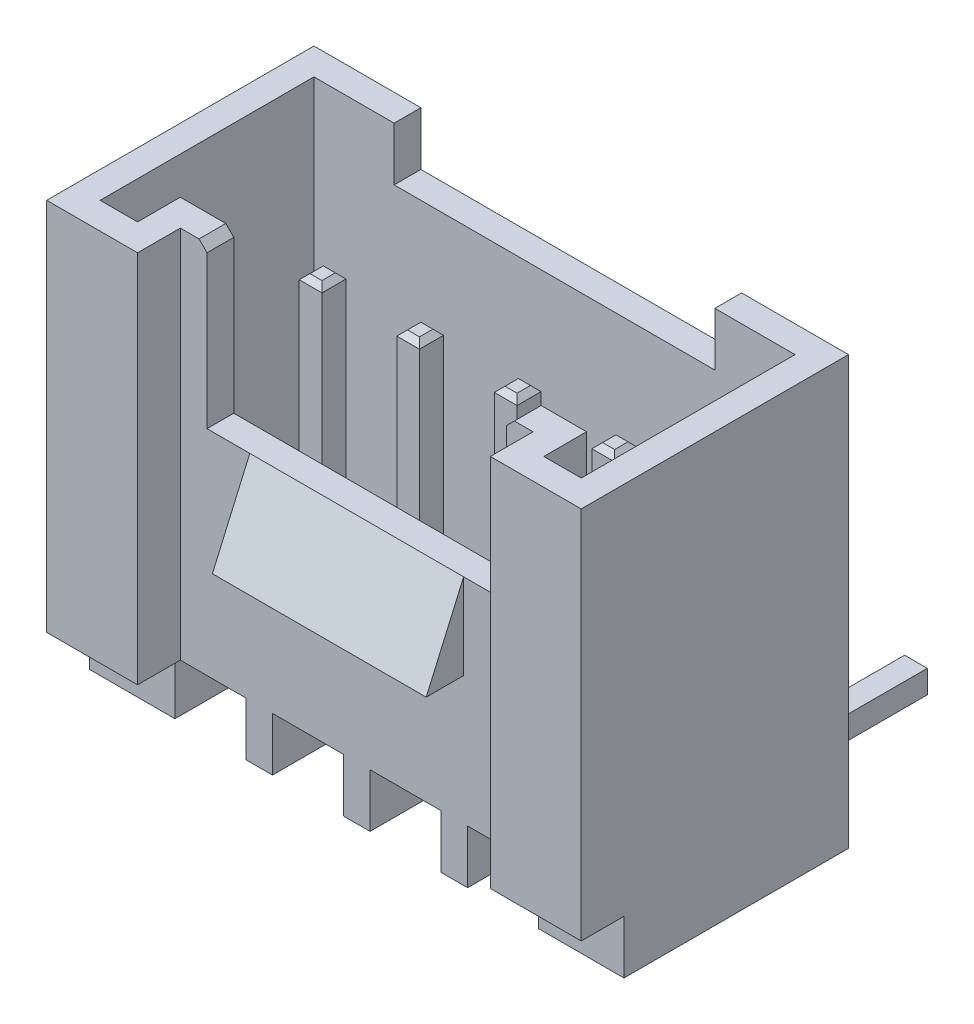
from build123d import *

# Parameters (mm, degrees)
ESQUISSE1_W             = 10
ESQUISSE1_H             = 5
BOSS_EXTRU_1_DEPTH      = 8
ESQUISSE2_W             = 6.6
ESQUISSE2_H             = 0.8
ENL_V_MAT_EXTRU_1_DEPTH = 8
ENL_V_MAT_EXTRU_2_DEPTH = 6.5
ESQUISSE5_W             = 6
ESQUISSE5_H             = 0.5
ENL_V_MAT_EXTRU_3_DEPTH = 1
ESQUISSE6_W             = 5.6
ESQUISSE6_H             = 0.5
ENL_V_MAT_EXTRU_4_DEPTH = 3
ESQUISSE7_W             = 0.8
ESQUISSE7_H             = 1
ENL_V_MAT_EXTRU_5_DEPTH = 10
ESQUISSE8_W             = 6.8
ESQUISSE8_H             = 4.2
ENL_V_MAT_EXTRU_6_DEPTH = 1
BOSS_EXTRU_2_DEPTH      = 6.8
BOSS_EXTRU_3_DEPTH      = 2
BOSS_EXTRU_3_DEPTH_BACK = 2
ESQUISSE12_W            = 0.5
ESQUISSE12_H            = 4.2
BOSS_EXTRU_4_DEPTH      = 1
CHANFREIN1_SIZE         = 0.15
BOSS_EXTRU_5_DEPTH      = 0.5
BOSS_EXTRU_5_DEPTH_BACK = 6.3
ESQUISSE13_W            = 0.425
ESQUISSE13_H            = 0.45
CHANFREIN2_SIZE         = 0.1
ESQUISSE14_W            = 0.425
ESQUISSE14_H            = 0.43
BOSS_EXTRU_6_DEPTH      = 5.5
CONG_1_R                = 0.1
CHANFREIN3_SIZE         = 0.1


with BuildPart() as part:
    # Esquisse1 → Boss.-Extru.1 (new body)
    with BuildSketch(Plane(origin=(0, 0, 0), x_dir=(1, 0, 0), z_dir=(0, 1, 0))):
        with Locations((5, 2.5)):
            Rectangle(ESQUISSE1_W, ESQUISSE1_H)
    extrude(amount=BOSS_EXTRU_1_DEPTH)

    # Esquisse2 → Enlèv. mat.-Extru.1 (cut)
    with BuildSketch(Plane(origin=(0, 8, 0), x_dir=(1, 0, 0), z_dir=(0, 1, 0))):
        with Locations((5, 0.4)):
            Rectangle(ESQUISSE2_W, ESQUISSE2_H)
    extrude(amount=-ENL_V_MAT_EXTRU_1_DEPTH, mode=Mode.SUBTRACT)

    # Esquisse4 → Enlèv. mat.-Extru.2 (cut)
    with BuildSketch(Plane(origin=(0, 8, 0), x_dir=(1, 0, 0), z_dir=(0, 1, 0))):
        Polygon((0.5, 0.5), (1.2, 0.5), (1.2, 1.3), (8.8, 1.3), (8.8, 0.5), (9.5, 0.5), (9.5, 4.5), (0.5, 4.5), align=None)
    extrude(amount=-ENL_V_MAT_EXTRU_2_DEPTH, mode=Mode.SUBTRACT)

    # Esquisse5 → Enlèv. mat.-Extru.3 (cut)
    with BuildSketch(Plane(origin=(0, 8, 0), x_dir=(1, 0, 0), z_dir=(0, 1, 0))):
        with Locations((5, 4.75)):
            Rectangle(ESQUISSE5_W, ESQUISSE5_H)
    extrude(amount=-ENL_V_MAT_EXTRU_3_DEPTH, mode=Mode.SUBTRACT)

    # Esquisse6 → Enlèv. mat.-Extru.4 (cut)
    with BuildSketch(Plane(origin=(0, 8, 0), x_dir=(1, 0, 0), z_dir=(0, 1, 0))):
        with Locations((5, 1.05)):
            Rectangle(ESQUISSE6_W, ESQUISSE6_H)
    extrude(amount=-ENL_V_MAT_EXTRU_4_DEPTH, mode=Mode.SUBTRACT)

    # Esquisse7 → Enlèv. mat.-Extru.5 (cut)
    with BuildSketch(Plane(origin=(10, 0, 0), x_dir=(0, 0, -1), z_dir=(1, 0, 0))):
        with Locations((0.4, 0.5)):
            Rectangle(ESQUISSE7_W, ESQUISSE7_H)
    extrude(amount=-ENL_V_MAT_EXTRU_5_DEPTH, mode=Mode.SUBTRACT)

    # Esquisse8 → Enlèv. mat.-Extru.6 (cut)
    with BuildSketch(Plane.XZ):
        with Locations((5, -2.9)):
            Rectangle(ESQUISSE8_W, ESQUISSE8_H)
    extrude(amount=-ENL_V_MAT_EXTRU_6_DEPTH, mode=Mode.SUBTRACT)

    # Esquisse9 → Boss.-Extru.2 (add)
    with BuildSketch(Plane(origin=(1.6, 0, 0), x_dir=(0, 0, -1), z_dir=(1, 0, 0))):
        Polygon((4.7, 1), (3.9, 0.2), (1.9, 0.2), (1.1, 1), align=None)
    extrude(amount=BOSS_EXTRU_2_DEPTH)

    # Esquisse11 → Boss.-Extru.3 (add, two sides: drawn at the far end of the back side and taken through both)
    with BuildSketch(Plane(origin=(5, 0, 0), x_dir=(0, 0, -1), z_dir=(1, 0, 0)).offset(-BOSS_EXTRU_3_DEPTH_BACK)):
        Polygon((0.8, 5), (0.1, 3.4), (0.8, 3.4), align=None)
    extrude(amount=BOSS_EXTRU_3_DEPTH + BOSS_EXTRU_3_DEPTH_BACK)

    # Esquisse12 → Boss.-Extru.4 (add)
    with BuildSketch(Plane(origin=(0, 1, 0), x_dir=(1, 0, 0), z_dir=(0, 1, 0))):
        with Locations((5, 2.9)):
            Rectangle(ESQUISSE12_W, ESQUISSE12_H)
        with Locations((3.175, 2.9)):
            Rectangle(ESQUISSE12_W, ESQUISSE12_H)
        with Locations((6.825, 2.9)):
            Rectangle(ESQUISSE12_W, ESQUISSE12_H)
    extrude(amount=-BOSS_EXTRU_4_DEPTH)

    # Chanfrein1
    chanfrein1_edges = [part.edges().sort_by_distance(p)[0] for p in [
        (2.2, 8, -1.05),
        (7.8, 8, -1.05),
    ]]
    chamfer(chanfrein1_edges, length=CHANFREIN1_SIZE)

    # Esquisse13 → Boss.-Extru.5 (add, two sides: drawn at the far end of the back side and taken through both)
    with BuildSketch(Plane.XZ.offset(-0.2).offset(-BOSS_EXTRU_5_DEPTH_BACK)):
        with Locations((2.2625, -2.9)):
            Rectangle(ESQUISSE13_W, ESQUISSE13_H)
        with Locations((4.0875, -2.9)):
            Rectangle(ESQUISSE13_W, ESQUISSE13_H)
        with Locations((5.9125, -2.9)):
            Rectangle(ESQUISSE13_W, ESQUISSE13_H)
        with Locations((7.7375, -2.9)):
            Rectangle(ESQUISSE13_W, ESQUISSE13_H)
    extrude(amount=BOSS_EXTRU_5_DEPTH + BOSS_EXTRU_5_DEPTH_BACK)

    # Chanfrein2
    chanfrein2_edges = [part.edges().sort_by_distance(p)[0] for p in [
        (2.05, 6.5, -2.9),
        (2.2625, 6.5, -2.675),
        (2.475, 6.5, -2.9),
        (2.2625, 6.5, -3.125),
        (4.3, 6.5, -2.9),
        (4.0875, 6.5, -3.125),
        (3.875, 6.5, -2.9),
        (4.0875, 6.5, -2.675),
        (5.7, 6.5, -2.9),
        (5.9125, 6.5, -2.675),
        (6.125, 6.5, -2.9),
        (5.9125, 6.5, -3.125),
        (7.7375, 6.5, -2.675),
        (7.95, 6.5, -2.9),
        (7.7375, 6.5, -3.125),
        (7.525, 6.5, -2.9),
    ]]
    chamfer(chanfrein2_edges, length=CHANFREIN2_SIZE)

    # Esquisse14 → Boss.-Extru.6 (add)
    with BuildSketch(Plane(origin=(0, 0, -3.125), x_dir=(-1, 0, 0), z_dir=(0, 0, -1))):
        with Locations((-7.7375, -0.085)):
            Rectangle(ESQUISSE14_W, ESQUISSE14_H)
        with Locations((-5.9125, -0.085)):
            Rectangle(ESQUISSE14_W, ESQUISSE14_H)
        with Locations((-4.0875, -0.085)):
            Rectangle(ESQUISSE14_W, ESQUISSE14_H)
        with Locations((-2.2625, -0.085)):
            Rectangle(ESQUISSE14_W, ESQUISSE14_H)
    extrude(amount=BOSS_EXTRU_6_DEPTH)

    # Congé1
    # the kernel refuses this fillet: 0.1 mm, written as the material it adds along each edge
    with BuildSketch(Plane(origin=(2.475, 0.13, -3.125), x_dir=(0, 0, -1), z_dir=(-1, 0, 0))) as cong_1_piece_1:
        with BuildLine():
            CenterArc((0.09539392, -0.1), CONG_1_R, 90, 72.542396876)
            Line((0, -0.07), (0, 0))
            Line((0, 0), (0.09539392, 0))
        make_face()
    extrude(amount=0.425)
    with BuildSketch(Plane(origin=(3.875, 0.13, -3.125), x_dir=(0, 0, -1), z_dir=(1, 0, 0)), Plane(origin=(7.525, 0.13, -3.125), x_dir=(0, 0, -1), z_dir=(1, 0, 0))) as cong_1_piece_2:
        with BuildLine():
            CenterArc((0.09539392, 0.1), CONG_1_R, 197.457603124, 72.542396876)
            Line((0, 0.07), (0, 0))
            Line((0, 0), (0.09539392, 0))
        make_face()
    extrude(amount=0.425)
    with BuildSketch(Plane(origin=(6.125, 0.13, -3.125), x_dir=(0, 1, 0), z_dir=(-1, 0, 0))) as cong_1_piece_3:
        with BuildLine():
            CenterArc((0.1, 0.09539392), CONG_1_R, 180, 72.542396876)
            Line((0, 0.09539392), (0, 0))
            Line((0, 0), (0.07, 0))
        make_face()
    extrude(amount=0.425)
    # the kernel refuses this fillet: 0.1 mm, written as the material it takes off along each edge
    with BuildSketch(Plane(origin=(1.8, -0.3, -2.675), x_dir=(0, 1, 0), z_dir=(1, 0, 0)), Plane(origin=(3.625, -0.3, -2.675), x_dir=(0, 1, 0), z_dir=(1, 0, 0))) as cong_1_2_piece_1:
        with BuildLine():
            CenterArc((CONG_1_R, -CONG_1_R), CONG_1_R, 90, 90)
            Line((0, -CONG_1_R), (0, 0))
            Line((0, 0), (CONG_1_R, 0))
        make_face()
    extrude(amount=0.925, mode=Mode.SUBTRACT)
    with BuildSketch(Plane(origin=(6.375, -0.3, -2.675), x_dir=(0, 1, 0), z_dir=(-1, 0, 0)), Plane(origin=(8.2, -0.3, -2.675), x_dir=(0, 1, 0), z_dir=(-1, 0, 0))) as cong_1_2_piece_2:
        with BuildLine():
            CenterArc((CONG_1_R, CONG_1_R), CONG_1_R, 180, 90)
            Line((0, CONG_1_R), (0, 0))
            Line((0, 0), (CONG_1_R, 0))
        make_face()
    extrude(amount=0.925, mode=Mode.SUBTRACT)

    # Chanfrein3
    chanfrein3_edges = [part.edges().sort_by_distance(p)[0] for p in [
        (7.95, -0.085, -8.625),
        (7.7375, -0.3, -8.625),
        (7.525, -0.085, -8.625),
        (7.7375, 0.13, -8.625),
        (5.7, -0.085, -8.625),
        (5.9125, 0.13, -8.625),
        (6.125, -0.085, -8.625),
        (5.9125, -0.3, -8.625),
        (4.3, -0.085, -8.625),
        (4.0875, -0.3, -8.625),
        (3.875, -0.085, -8.625),
        (4.0875, 0.13, -8.625),
        (2.05, -0.085, -8.625),
        (2.2625, 0.13, -8.625),
        (2.475, -0.085, -8.625),
        (2.2625, -0.3, -8.625),
    ]]
    chamfer(chanfrein3_edges, length=CHANFREIN3_SIZE)


solid = part.part
